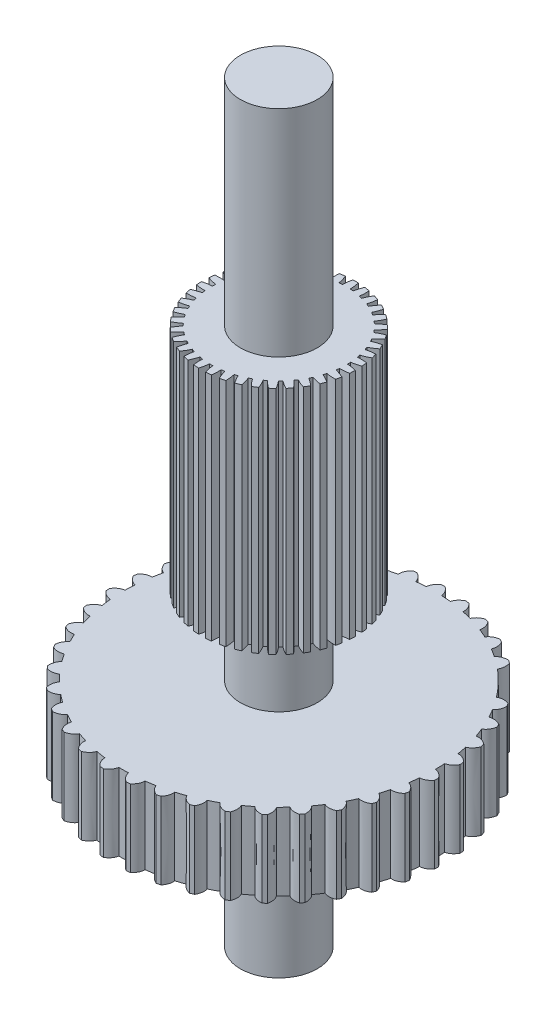
from build123d import *

# Parameters (mm, degrees)
BOSS_EXTRUDE1_DEPTH = 1
SKETCH2_R           = 0.5
BOSS_EXTRUDE2_DEPTH = 1
BOSS_EXTRUDE3_START = 2
SKETCH3_R           = 0.5
BOSS_EXTRUDE3_DEPTH = 2
SKETCH5_R           = 0.88
BOSS_EXTRUDE5_DEPTH = 3
SKETCH6_R           = 0.5
BOSS_EXTRUDE6_DEPTH = 2.8


with BuildPart() as part:
    # Sketch1 → Boss-Extrude1 (new body)
    with BuildSketch(Plane(origin=(0, 0, 0), x_dir=(1, 0, 0), z_dir=(0, 1, 0))):
        with BuildLine():
            Line((0.025, 2.14), (-0.025, 2.14))
            add(Edge.make_bspline(
                [(-0.025, 2.14), (-0.094687317, 2.087833824), (-0.1, 2.017523234)],
                knots=[0, 0, 0, 0.858328442, 0.858328442, 0.858328442], degree=2))
            ThreePointArc((-0.1, 2.017523234), (-0.162542469, 2.013449762), (-0.22492846, 2.007437966))
            add(Edge.make_bspline(
                [(-0.318603884, 2.116297844), (-0.241450957, 2.075985838), (-0.22492846, 2.007437966)],
                knots=[0, 0, 0, 0.858328442, 0.858328442, 0.858328442], degree=2))
            Line((-0.318603884, 2.116297844), (-0.367956398, 2.10827728))
            add(Edge.make_bspline(
                [(-0.367956398, 2.10827728), (-0.428373239, 2.045608011), (-0.422338512, 1.97535571)],
                knots=[0, 0, 0, 0.858328442, 0.858328442, 0.858328442], degree=2))
            ThreePointArc((-0.422338512, 1.97535571), (-0.483417642, 1.961302471), (-0.544031391, 1.945361109))
            add(Edge.make_bspline(
                [(-0.653956096, 2.037784686), (-0.571335778, 2.010370909), (-0.544031391, 1.945361109)],
                knots=[0, 0, 0, 0.858328442, 0.858328442, 0.858328442], degree=2))
            Line((-0.653956096, 2.037784686), (-0.701382918, 2.021951286))
            add(Edge.make_bspline(
                [(-0.701382918, 2.021951286), (-0.750964519, 1.950402024), (-0.733738679, 1.882027511)],
                knots=[0, 0, 0, 0.858328442, 0.858328442, 0.858328442], degree=2))
            ThreePointArc((-0.733738679, 1.882027511), (-0.791772552, 1.858358476), (-0.849044194, 1.832900422))
            add(Edge.make_bspline(
                [(-0.972371188, 1.906493974), (-0.886423302, 1.89268843), (-0.849044194, 1.832900422)],
                knots=[0, 0, 0, 0.858328442, 0.858328442, 0.858328442], degree=2))
            Line((-0.972371188, 1.906493974), (-1.016643989, 1.883257816))
            add(Edge.make_bspline(
                [(-1.016643989, 1.883257816), (-1.054106212, 1.80468165), (-1.0261354, 1.739955787)],
                knots=[0, 0, 0, 0.858328442, 0.858328442, 0.858328442], degree=2))
            ThreePointArc((-1.0261354, 1.739955787), (-1.079620969, 1.707283973), (-1.132067199, 1.672968576))
            add(Edge.make_bspline(
                [(-1.265602376, 1.72582607), (-1.178552929, 1.725986315), (-1.132067199, 1.672968576)],
                knots=[0, 0, 0, 0.858328442, 0.858328442, 0.858328442], degree=2))
            Line((-1.265602376, 1.72582607), (-1.305574515, 1.695788957))
            add(Edge.make_bspline(
                [(-1.305574515, 1.695788957), (-1.329947109, 1.612220969), (-1.291955752, 1.552820123)],
                knots=[0, 0, 0, 0.858328442, 0.858328442, 0.858328442], degree=2))
            ThreePointArc((-1.291955752, 1.552820123), (-1.33950777, 1.511991711), (-1.385770259, 1.469707723))
            add(Edge.make_bspline(
                [(-1.526055128, 1.500460178), (-1.440158653, 1.51458206), (-1.385770259, 1.469707723)],
                knots=[0, 0, 0, 0.858328442, 0.858328442, 0.858328442], degree=2))
            Line((-1.526055128, 1.500460178), (-1.560691346, 1.464400055))
            add(Edge.make_bspline(
                [(-1.560691346, 1.464400055), (-1.571343074, 1.378004612), (-1.524315129, 1.325467233)],
                knots=[0, 0, 0, 0.858328442, 0.858328442, 0.858328442], degree=2))
            ThreePointArc((-1.524315129, 1.325467233), (-1.564702023, 1.277539659), (-1.603582596, 1.228382212))
            add(Edge.make_bspline(
                [(-1.746983854, 1.236233155), (-1.664465025, 1.263950926), (-1.603582596, 1.228382212)],
                knots=[0, 0, 0, 0.858328442, 0.858328442, 0.858328442], degree=2))
            Line((-1.746983854, 1.236233155), (-1.775387092, 1.195083961))
            add(Edge.make_bspline(
                [(-1.775387092, 1.195083961), (-1.772042078, 1.108098659), (-1.717195545, 1.063785438)],
                knots=[0, 0, 0, 0.858328442, 0.858328442, 0.858328442], degree=2))
            ThreePointArc((-1.717195545, 1.063785438), (-1.749371316, 1.01), (-1.779862987, 0.955242246))
            add(Edge.make_bspline(
                [(-1.922666616, 0.939988342), (-1.845662627, 0.980584127), (-1.779862987, 0.955242246)],
                knots=[0, 0, 0, 0.858328442, 0.858328442, 0.858328442], degree=2))
            Line((-1.922666616, 0.939988342), (-1.944101244, 0.894815821))
            add(Edge.make_bspline(
                [(-1.944101244, 0.894815821), (-1.926846124, 0.809493533), (-1.865601499, 0.774552159)],
                knots=[0, 0, 0, 0.858328442, 0.858328442, 0.858328442], degree=2))
            ThreePointArc((-1.865601499, 0.774552159), (-1.88873281, 0.716301872), (-1.910045861, 0.657362009))
            add(Edge.make_bspline(
                [(-2.048553322, 0.619398326), (-1.979058537, 0.671820714), (-1.910045861, 0.657362009)],
                knots=[0, 0, 0, 0.858328442, 0.858328442, 0.858328442], degree=2))
            Line((-2.048553322, 0.619398326), (-2.062464195, 0.57137242))
            add(Edge.make_bspline(
                [(-2.062464195, 0.57137242), (-2.031745867, 0.489922949), (-1.965689353, 0.465258386)],
                knots=[0, 0, 0, 0.858328442, 0.858328442, 0.858328442], degree=2))
            ThreePointArc((-1.965689353, 0.465258386), (-1.979177117, 0.404051901), (-1.99075955, 0.34245644))
            add(Edge.make_bspline(
                [(-2.121383574, 0.282766218), (-2.06119787, 0.345657497), (-1.99075955, 0.34245644)],
                knots=[0, 0, 0, 0.858328442, 0.858328442, 0.858328442], degree=2))
            Line((-2.121383574, 0.282766218), (-2.127410408, 0.233130774))
            add(Edge.make_bspline(
                [(-2.127410408, 0.233130774), (-2.08402446, 0.157663619), (-2.014866886, 0.143914666)],
                knots=[0, 0, 0, 0.858328442, 0.858328442, 0.858328442], degree=2))
            ThreePointArc((-2.014866886, 0.143914666), (-2.018361776, 0.081337199), (-2.019913613, 0.01868143))
            add(Edge.make_bspline(
                [(-2.139271105, -0.061189387), (-2.089953261, 0.010541933), (-2.019913613, 0.01868143)],
                knots=[0, 0, 0, 0.858328442, 0.858328442, 0.858328442], degree=2))
            Line((-2.139271105, -0.061189387), (-2.137257808, -0.111148837))
            add(Edge.make_bspline(
                [(-2.137257808, -0.111148837), (-2.082327913, -0.178679117), (-2.011860425, -0.18115637)],
                knots=[0, 0, 0, 0.858328442, 0.858328442, 0.858328442], degree=2))
            ThreePointArc((-2.011860425, -0.18115637), (-2.005271926, -0.243484094), (-1.996752974, -0.305577419))
            add(Edge.make_bspline(
                [(-2.101752638, -0.403560218), (-2.06457996, -0.324846662), (-1.996752974, -0.305577419)],
                knots=[0, 0, 0, 0.858328442, 0.858328442, 0.858328442], degree=2))
            Line((-2.101752638, -0.403560218), (-2.091751353, -0.452549751))
            add(Edge.make_bspline(
                [(-2.091751353, -0.452549751), (-2.026700168, -0.510394157), (-1.956747836, -0.50153555)],
                knots=[0, 0, 0, 0.858328442, 0.858328442, 0.858328442], degree=2))
            ThreePointArc((-1.956747836, -0.50153555), (-1.940246585, -0.561999277), (-1.921877483, -0.621921974))
            add(Edge.make_bspline(
                [(-2.009799882, -0.735479052), (-1.985735123, -0.651821898), (-1.921877483, -0.621921974)],
                knots=[0, 0, 0, 0.858328442, 0.858328442, 0.858328442], degree=2))
            Line((-2.009799882, -0.735479052), (-1.992069637, -0.782229864))
            add(Edge.make_bspline(
                [(-1.992069637, -0.782229864), (-1.918581952, -0.828890256), (-1.850956505, -0.808925223)],
                knots=[0, 0, 0, 0.858328442, 0.858328442, 0.858328442], degree=2))
            ThreePointArc((-1.850956505, -0.808925223), (-1.824969878, -0.865958974), (-1.797226373, -0.922159077))
            add(Edge.make_bspline(
                [(-1.865794364, -1.048349365), (-1.855460789, -0.96191529), (-1.797226373, -0.922159077)],
                knots=[0, 0, 0, 0.858328442, 0.858328442, 0.858328442], degree=2))
            Line((-1.865794364, -1.048349365), (-1.840794364, -1.091650635))
            add(Edge.make_bspline(
                [(-1.840794364, -1.091650635), (-1.760773472, -1.125918534), (-1.697226373, -1.095364157)],
                knots=[0, 0, 0, 0.858328442, 0.858328442, 0.858328442], degree=2))
            ThreePointArc((-1.697226373, -1.095364157), (-1.662427409, -1.147490788), (-1.626028045, -1.198512743))
            add(Edge.make_bspline(
                [(-1.673465753, -1.33406798), (-1.677130995, -1.247095582), (-1.626028045, -1.198512743)],
                knots=[0, 0, 0, 0.858328442, 0.858328442, 0.858328442], degree=2))
            Line((-1.673465753, -1.33406798), (-1.641843484, -1.372798228))
            add(Edge.make_bspline(
                [(-1.641843484, -1.372798228), (-1.557361884, -1.393786112), (-1.49953897, -1.353433736)],
                knots=[0, 0, 0, 0.858328442, 0.858328442, 0.858328442], degree=2))
            ThreePointArc((-1.49953897, -1.353433736), (-1.456828944, -1.399303194), (-1.412716445, -1.44382556))
            add(Edge.make_bspline(
                [(-1.437795257, -1.585234935), (-1.45536439, -1.499976753), (-1.412716445, -1.44382556)],
                knots=[0, 0, 0, 0.858328442, 0.858328442, 0.858328442], degree=2))
            Line((-1.437795257, -1.585234935), (-1.40036972, -1.618391068))
            add(Edge.make_bspline(
                [(-1.40036972, -1.618391068), (-1.313615441, -1.625555363), (-1.263014295, -1.576450091)],
                knots=[0, 0, 0, 0.858328442, 0.858328442, 0.858328442], degree=2))
            ThreePointArc((-1.263014295, -1.576450091), (-1.213499374, -1.614874382), (-1.162816231, -1.651744052))
            add(Edge.make_bspline(
                [(-1.16488662, -1.795345137), (-1.195904611, -1.714009313), (-1.162816231, -1.651744052)],
                knots=[0, 0, 0, 0.858328442, 0.858328442, 0.858328442], degree=2))
            Line((-1.16488662, -1.795345137), (-1.122627116, -1.822068429))
            add(Edge.make_bspline(
                [(-1.122627116, -1.822068429), (-1.035847048, -1.815223583), (-0.993778213, -1.758637217)],
                knots=[0, 0, 0, 0.858328442, 0.858328442, 0.858328442], degree=2))
            ThreePointArc((-0.993778213, -1.758637217), (-0.938740808, -1.788621172), (-0.882799687, -1.816883241))
            add(Edge.make_bspline(
                [(-0.861808031, -1.958956844), (-0.905471531, -1.883649933), (-0.882799687, -1.816883241)],
                knots=[0, 0, 0, 0.858328442, 0.858328442, 0.858328442], degree=2))
            Line((-0.861808031, -1.958956844), (-0.815809059, -1.978555175))
            add(Edge.make_bspline(
                [(-0.815809059, -1.978555175), (-0.731250761, -1.957878466), (-0.698803798, -1.895276563)],
                knots=[0, 0, 0, 0.858328442, 0.858328442, 0.858328442], degree=2))
            ThreePointArc((-0.698803798, -1.895276563), (-0.639669347, -1.916043613), (-0.579919095, -1.934966109))
            add(Edge.make_bspline(
                [(-0.536409067, -2.071832598), (-0.591587214, -2.00450501), (-0.579919095, -1.934966109)],
                knots=[0, 0, 0, 0.858328442, 0.858328442, 0.858328442], degree=2))
            Line((-0.536409067, -2.071832598), (-0.487861976, -2.083798381))
            add(Edge.make_bspline(
                [(-0.487861976, -2.083798381), (-0.407715463, -2.049825326), (-0.385730731, -1.982829242)],
                knots=[0, 0, 0, 0.858328442, 0.858328442, 0.858328442], degree=2))
            ThreePointArc((-0.385730731, -1.982829242), (-0.324030787, -1.993841531), (-0.262018903, -2.002934371))
            add(Edge.make_bspline(
                [(-0.19711739, -2.131048975), (-0.262381099, -2.073444459), (-0.262018903, -2.002934371)],
                knots=[0, 0, 0, 0.858328442, 0.858328442, 0.858328442], degree=2))
            Line((-0.19711739, -2.131048975), (-0.147279524, -2.135072304))
            add(Edge.make_bspline(
                [(-0.147279524, -2.135072304), (-0.073620549, -2.088682786), (-0.062667441, -2.019027685)],
                knots=[0, 0, 0, 0.858328442, 0.858328442, 0.858328442], degree=2))
            ThreePointArc((-0.062667441, -2.019027685), (0, -2.02), (0.062667441, -2.019027685))
            add(Edge.make_bspline(
                [(0.147279524, -2.135072304), (0.073620549, -2.088682786), (0.062667441, -2.019027685)],
                knots=[0, 0, 0, 0.858328442, 0.858328442, 0.858328442], degree=2))
            Line((0.147279524, -2.135072304), (0.19711739, -2.131048975))
            add(Edge.make_bspline(
                [(0.19711739, -2.131048975), (0.262381099, -2.073444459), (0.262018903, -2.002934371)],
                knots=[0, 0, 0, 0.858328442, 0.858328442, 0.858328442], degree=2))
            ThreePointArc((0.262018903, -2.002934371), (0.324030787, -1.993841531), (0.385730731, -1.982829242))
            add(Edge.make_bspline(
                [(0.487861976, -2.083798381), (0.407715463, -2.049825326), (0.385730731, -1.982829242)],
                knots=[0, 0, 0, 0.858328442, 0.858328442, 0.858328442], degree=2))
            Line((0.487861976, -2.083798381), (0.536409067, -2.071832598))
            add(Edge.make_bspline(
                [(0.536409067, -2.071832598), (0.591587214, -2.00450501), (0.579919095, -1.934966109)],
                knots=[0, 0, 0, 0.858328442, 0.858328442, 0.858328442], degree=2))
            ThreePointArc((0.579919095, -1.934966109), (0.639669347, -1.916043613), (0.698803798, -1.895276563))
            add(Edge.make_bspline(
                [(0.815809059, -1.978555175), (0.731250761, -1.957878466), (0.698803798, -1.895276563)],
                knots=[0, 0, 0, 0.858328442, 0.858328442, 0.858328442], degree=2))
            Line((0.815809059, -1.978555175), (0.861808031, -1.958956844))
            add(Edge.make_bspline(
                [(0.861808031, -1.958956844), (0.905471531, -1.883649933), (0.882799687, -1.816883241)],
                knots=[0, 0, 0, 0.858328442, 0.858328442, 0.858328442], degree=2))
            ThreePointArc((0.882799687, -1.816883241), (0.938740808, -1.788621172), (0.993778213, -1.758637217))
            add(Edge.make_bspline(
                [(1.122627116, -1.822068429), (1.035847048, -1.815223583), (0.993778213, -1.758637217)],
                knots=[0, 0, 0, 0.858328442, 0.858328442, 0.858328442], degree=2))
            Line((1.122627116, -1.822068429), (1.16488662, -1.795345137))
            add(Edge.make_bspline(
                [(1.16488662, -1.795345137), (1.195904611, -1.714009313), (1.162816231, -1.651744052)],
                knots=[0, 0, 0, 0.858328442, 0.858328442, 0.858328442], degree=2))
            ThreePointArc((1.162816231, -1.651744052), (1.213499374, -1.614874382), (1.263014295, -1.576450091))
            add(Edge.make_bspline(
                [(1.40036972, -1.618391068), (1.313615441, -1.625555363), (1.263014295, -1.576450091)],
                knots=[0, 0, 0, 0.858328442, 0.858328442, 0.858328442], degree=2))
            Line((1.40036972, -1.618391068), (1.437795257, -1.585234935))
            add(Edge.make_bspline(
                [(1.437795257, -1.585234935), (1.45536439, -1.499976753), (1.412716445, -1.44382556)],
                knots=[0, 0, 0, 0.858328442, 0.858328442, 0.858328442], degree=2))
            ThreePointArc((1.412716445, -1.44382556), (1.456828944, -1.399303194), (1.49953897, -1.353433736))
            add(Edge.make_bspline(
                [(1.641843484, -1.372798228), (1.557361884, -1.393786112), (1.49953897, -1.353433736)],
                knots=[0, 0, 0, 0.858328442, 0.858328442, 0.858328442], degree=2))
            Line((1.641843484, -1.372798228), (1.673465753, -1.33406798))
            add(Edge.make_bspline(
                [(1.673465753, -1.33406798), (1.677130995, -1.247095582), (1.626028045, -1.198512743)],
                knots=[0, 0, 0, 0.858328442, 0.858328442, 0.858328442], degree=2))
            ThreePointArc((1.626028045, -1.198512743), (1.662427409, -1.147490788), (1.697226373, -1.095364157))
            add(Edge.make_bspline(
                [(1.840794364, -1.091650635), (1.760773472, -1.125918534), (1.697226373, -1.095364157)],
                knots=[0, 0, 0, 0.858328442, 0.858328442, 0.858328442], degree=2))
            Line((1.840794364, -1.091650635), (1.865794364, -1.048349365))
            add(Edge.make_bspline(
                [(1.865794364, -1.048349365), (1.855460789, -0.96191529), (1.797226373, -0.922159077)],
                knots=[0, 0, 0, 0.858328442, 0.858328442, 0.858328442], degree=2))
            ThreePointArc((1.797226373, -0.922159077), (1.824969878, -0.865958974), (1.850956505, -0.808925223))
            add(Edge.make_bspline(
                [(1.992069637, -0.782229864), (1.918581952, -0.828890256), (1.850956505, -0.808925223)],
                knots=[0, 0, 0, 0.858328442, 0.858328442, 0.858328442], degree=2))
            Line((1.992069637, -0.782229864), (2.009799882, -0.735479052))
            add(Edge.make_bspline(
                [(2.009799882, -0.735479052), (1.985735123, -0.651821898), (1.921877483, -0.621921974)],
                knots=[0, 0, 0, 0.858328442, 0.858328442, 0.858328442], degree=2))
            ThreePointArc((1.921877483, -0.621921974), (1.940246585, -0.561999277), (1.956747836, -0.50153555))
            add(Edge.make_bspline(
                [(2.091751353, -0.452549751), (2.026700168, -0.510394157), (1.956747836, -0.50153555)],
                knots=[0, 0, 0, 0.858328442, 0.858328442, 0.858328442], degree=2))
            Line((2.091751353, -0.452549751), (2.101752638, -0.403560218))
            add(Edge.make_bspline(
                [(2.101752638, -0.403560218), (2.06457996, -0.324846662), (1.996752974, -0.305577419)],
                knots=[0, 0, 0, 0.858328442, 0.858328442, 0.858328442], degree=2))
            ThreePointArc((1.996752974, -0.305577419), (2.005271926, -0.243484094), (2.011860425, -0.18115637))
            add(Edge.make_bspline(
                [(2.137257808, -0.111148837), (2.082327913, -0.178679117), (2.011860425, -0.18115637)],
                knots=[0, 0, 0, 0.858328442, 0.858328442, 0.858328442], degree=2))
            Line((2.137257808, -0.111148837), (2.139271105, -0.061189387))
            add(Edge.make_bspline(
                [(2.139271105, -0.061189387), (2.089953261, 0.010541933), (2.019913613, 0.01868143)],
                knots=[0, 0, 0, 0.858328442, 0.858328442, 0.858328442], degree=2))
            ThreePointArc((2.019913613, 0.01868143), (2.018361776, 0.081337199), (2.014866886, 0.143914666))
            add(Edge.make_bspline(
                [(2.127410408, 0.233130774), (2.08402446, 0.157663619), (2.014866886, 0.143914666)],
                knots=[0, 0, 0, 0.858328442, 0.858328442, 0.858328442], degree=2))
            Line((2.127410408, 0.233130774), (2.121383574, 0.282766218))
            add(Edge.make_bspline(
                [(2.121383574, 0.282766218), (2.06119787, 0.345657497), (1.99075955, 0.34245644)],
                knots=[0, 0, 0, 0.858328442, 0.858328442, 0.858328442], degree=2))
            ThreePointArc((1.99075955, 0.34245644), (1.979177117, 0.404051901), (1.965689353, 0.465258386))
            add(Edge.make_bspline(
                [(2.062464195, 0.57137242), (2.031745867, 0.489922949), (1.965689353, 0.465258386)],
                knots=[0, 0, 0, 0.858328442, 0.858328442, 0.858328442], degree=2))
            Line((2.062464195, 0.57137242), (2.048553322, 0.619398326))
            add(Edge.make_bspline(
                [(2.048553322, 0.619398326), (1.979058537, 0.671820714), (1.910045861, 0.657362009)],
                knots=[0, 0, 0, 0.858328442, 0.858328442, 0.858328442], degree=2))
            ThreePointArc((1.910045861, 0.657362009), (1.88873281, 0.716301872), (1.865601499, 0.774552159))
            add(Edge.make_bspline(
                [(1.944101244, 0.894815821), (1.926846124, 0.809493533), (1.865601499, 0.774552159)],
                knots=[0, 0, 0, 0.858328442, 0.858328442, 0.858328442], degree=2))
            Line((1.944101244, 0.894815821), (1.922666616, 0.939988342))
            add(Edge.make_bspline(
                [(1.922666616, 0.939988342), (1.845662627, 0.980584127), (1.779862987, 0.955242246)],
                knots=[0, 0, 0, 0.858328442, 0.858328442, 0.858328442], degree=2))
            ThreePointArc((1.779862987, 0.955242246), (1.749371316, 1.01), (1.717195545, 1.063785438))
            add(Edge.make_bspline(
                [(1.775387092, 1.195083961), (1.772042078, 1.108098659), (1.717195545, 1.063785438)],
                knots=[0, 0, 0, 0.858328442, 0.858328442, 0.858328442], degree=2))
            Line((1.775387092, 1.195083961), (1.746983854, 1.236233155))
            add(Edge.make_bspline(
                [(1.746983854, 1.236233155), (1.664465025, 1.263950926), (1.603582596, 1.228382212)],
                knots=[0, 0, 0, 0.858328442, 0.858328442, 0.858328442], degree=2))
            ThreePointArc((1.603582596, 1.228382212), (1.456828944, 1.399303194), (1.291955752, 1.552820123))
            add(Edge.make_bspline(
                [(1.305574515, 1.695788957), (1.329947109, 1.612220969), (1.291955752, 1.552820123)],
                knots=[0, 0, 0, 0.858328442, 0.858328442, 0.858328442], degree=2))
            Line((1.305574515, 1.695788957), (1.265602376, 1.72582607))
            add(Edge.make_bspline(
                [(1.265602376, 1.72582607), (1.178552929, 1.725986315), (1.132067199, 1.672968576)],
                knots=[0, 0, 0, 0.858328442, 0.858328442, 0.858328442], degree=2))
            ThreePointArc((1.132067199, 1.672968576), (1.079620969, 1.707283973), (1.0261354, 1.739955787))
            add(Edge.make_bspline(
                [(1.016643989, 1.883257816), (1.054106212, 1.80468165), (1.0261354, 1.739955787)],
                knots=[0, 0, 0, 0.858328442, 0.858328442, 0.858328442], degree=2))
            Line((1.016643989, 1.883257816), (0.972371188, 1.906493974))
            add(Edge.make_bspline(
                [(0.972371188, 1.906493974), (0.886423302, 1.89268843), (0.849044194, 1.832900422)],
                knots=[0, 0, 0, 0.858328442, 0.858328442, 0.858328442], degree=2))
            ThreePointArc((0.849044194, 1.832900422), (0.791772552, 1.858358476), (0.733738679, 1.882027511))
            add(Edge.make_bspline(
                [(0.701382918, 2.021951286), (0.750964519, 1.950402024), (0.733738679, 1.882027511)],
                knots=[0, 0, 0, 0.858328442, 0.858328442, 0.858328442], degree=2))
            Line((0.701382918, 2.021951286), (0.653956096, 2.037784686))
            add(Edge.make_bspline(
                [(0.653956096, 2.037784686), (0.571335778, 2.010370909), (0.544031391, 1.945361109)],
                knots=[0, 0, 0, 0.858328442, 0.858328442, 0.858328442], degree=2))
            ThreePointArc((0.544031391, 1.945361109), (0.483417642, 1.961302471), (0.422338512, 1.97535571))
            add(Edge.make_bspline(
                [(0.367956398, 2.10827728), (0.428373239, 2.045608011), (0.422338512, 1.97535571)],
                knots=[0, 0, 0, 0.858328442, 0.858328442, 0.858328442], degree=2))
            Line((0.367956398, 2.10827728), (0.318603884, 2.116297844))
            add(Edge.make_bspline(
                [(0.318603884, 2.116297844), (0.241450957, 2.075985838), (0.22492846, 2.007437966)],
                knots=[0, 0, 0, 0.858328442, 0.858328442, 0.858328442], degree=2))
            ThreePointArc((0.22492846, 2.007437966), (0.162542469, 2.013449762), (0.1, 2.017523234))
            add(Edge.make_bspline(
                [(0.025, 2.14), (0.094687317, 2.087833824), (0.1, 2.017523234)],
                knots=[0, 0, 0, 0.858328442, 0.858328442, 0.858328442], degree=2))
        make_face()
    extrude(amount=BOSS_EXTRUDE1_DEPTH)

    # Sketch2 → Boss-Extrude2 (add)
    with BuildSketch(Plane(origin=(0, 1, 0), x_dir=(1, 0, 0), z_dir=(0, 1, 0))):
        Circle(SKETCH2_R)
    extrude(amount=BOSS_EXTRUDE2_DEPTH)

    # Sketch3 → Boss-Extrude3 (add)
    with BuildSketch(Plane.XZ.offset(BOSS_EXTRUDE3_START)):
        Circle(SKETCH3_R)
    extrude(amount=-BOSS_EXTRUDE3_DEPTH)

    # Sketch5 → Boss-Extrude5 (add)
    with BuildSketch(Plane(origin=(0, 2, 0), x_dir=(1, 0, 0), z_dir=(0, 1, 0))):
        Circle(SKETCH5_R)
        with BuildLine():
            Line((-0.035, 1), (0.035, 1))
            add(Edge.make_bspline(
                [(0.035, 1), (0.048647076, 0.939667454), (0.05, 0.878578397)],
                knots=[0, 0, 0, 0.819610194, 0.819610194, 0.819610194], degree=2))
            Line((0.05, 0.878578397), (0, 0.88))
            Line((0, 0.88), (-0.05, 0.878578397))
            add(Edge.make_bspline(
                [(-0.035, 1), (-0.048647076, 0.939667454), (-0.05, 0.878578397)],
                knots=[0, 0, 0, 0.819610194, 0.819610194, 0.819610194], degree=2))
        make_face()
        with BuildLine():
            Line((0.125864522, 0.992664657), (0.19495804, 0.981435868))
            add(Edge.make_bspline(
                [(0.19495804, 0.981435868), (0.198750369, 0.919695467), (0.190286399, 0.859180474)],
                knots=[0, 0, 0, 0.819610194, 0.819610194, 0.819610194], degree=2))
            Line((0.190286399, 0.859180474), (0.141161927, 0.868604231))
            Line((0.141161927, 0.868604231), (0.091581373, 0.875221602))
            add(Edge.make_bspline(
                [(0.125864522, 0.992664657), (0.10271615, 0.935302547), (0.091581373, 0.875221602)],
                knots=[0, 0, 0, 0.819610194, 0.819610194, 0.819610194], degree=2))
        make_face()
        with BuildLine():
            Line((0.283469218, 0.959619822), (0.349866769, 0.937453062))
            add(Edge.make_bspline(
                [(0.349866769, 0.937453062), (0.343706132, 0.875903851), (0.325644481, 0.817530227)],
                knots=[0, 0, 0, 0.819610194, 0.819610194, 0.819610194], degree=2))
            Line((0.325644481, 0.817530227), (0.278667835, 0.834712069))
            Line((0.278667835, 0.834712069), (0.230790836, 0.849197027))
            add(Edge.make_bspline(
                [(0.283469218, 0.959619822), (0.251419083, 0.906713795), (0.230790836, 0.849197027)],
                knots=[0, 0, 0, 0.819610194, 0.819610194, 0.819610194], degree=2))
        make_face()
        with BuildLine():
            Line((0.433732211, 0.901721337), (0.495714133, 0.869190715))
            add(Edge.make_bspline(
                [(0.495714133, 0.869190715), (0.479760087, 0.809426785), (0.452568541, 0.754706377)],
                knots=[0, 0, 0, 0.819610194, 0.819610194, 0.819610194], degree=2))
            Line((0.452568541, 0.754706377), (0.408956391, 0.779201303))
            Line((0.408956391, 0.779201303), (0.364022938, 0.801178694))
            add(Edge.make_bspline(
                [(0.433732211, 0.901721337), (0.393610393, 0.854641633), (0.364022938, 0.801178694)],
                knots=[0, 0, 0, 0.819610194, 0.819610194, 0.819610194], degree=2))
        make_face()
        with BuildLine():
            Line((0.572761768, 0.820468743), (0.628722761, 0.778416784))
            add(Edge.make_bspline(
                [(0.628722761, 0.778416784), (0.603388507, 0.721985991), (0.567771314, 0.672336029)],
                knots=[0, 0, 0, 0.819610194, 0.819610194, 0.819610194], degree=2))
            Line((0.567771314, 0.672336029), (0.528653193, 0.703509632))
            Line((0.528653193, 0.703509632), (0.487827037, 0.732410255))
            add(Edge.make_bspline(
                [(0.572761768, 0.820468743), (0.525607401, 0.780434701), (0.487827037, 0.732410255)],
                knots=[0, 0, 0, 0.819610194, 0.819610194, 0.819610194], degree=2))
        make_face()
        with BuildLine():
            Line((0.696957095, 0.717966439), (0.7454478, 0.667482268))
            add(Edge.make_bspline(
                [(0.7454478, 0.667482268), (0.711389482, 0.615846139), (0.668269108, 0.57255253)],
                knots=[0, 0, 0, 0.819610194, 0.819610194, 0.819610194], degree=2))
            Line((0.668269108, 0.57255253), (0.634658154, 0.609597431))
            Line((0.634658154, 0.609597431), (0.598996673, 0.644672775))
            add(Edge.make_bspline(
                [(0.696957095, 0.717966439), (0.643991453, 0.68601492), (0.598996673, 0.644672775)],
                knots=[0, 0, 0, 0.819610194, 0.819610194, 0.819610194], degree=2))
        make_face()
        with BuildLine():
            Line((0.8031016, 0.596869182), (0.842866132, 0.539260311))
            add(Edge.make_bspline(
                [(0.842866132, 0.539260311), (0.800965843, 0.493756195), (0.751459083, 0.457940221)],
                knots=[0, 0, 0, 0.819610194, 0.819610194, 0.819610194], degree=2))
            Line((0.751459083, 0.457940221), (0.724225802, 0.499896977))
            Line((0.724225802, 0.499896977), (0.694652608, 0.540238608))
            add(Edge.make_bspline(
                [(0.8031016, 0.596869182), (0.745696465, 0.573827713), (0.694652608, 0.540238608)],
                knots=[0, 0, 0, 0.819610194, 0.819610194, 0.819610194], degree=2))
        make_face()
        with BuildLine():
            Line((0.888446195, 0.460313327), (0.918454674, 0.397071796))
            add(Edge.make_bspline(
                [(0.918454674, 0.397071796), (0.869797609, 0.358878225), (0.815186663, 0.331467502)],
                knots=[0, 0, 0, 0.819610194, 0.819610194, 0.819610194], degree=2))
            Line((0.815186663, 0.331467502), (0.795036382, 0.377249454))
            Line((0.795036382, 0.377249454), (0.772317407, 0.421812545))
            add(Edge.make_bspline(
                [(0.888446195, 0.460313327), (0.82808833, 0.44677867), (0.772317407, 0.421812545)],
                knots=[0, 0, 0, 0.819610194, 0.819610194, 0.819610194], degree=2))
        make_face()
        with BuildLine():
            Line((0.9507805, 0.311835598), (0.970255723, 0.24459933))
            add(Edge.make_bspline(
                [(0.970255723, 0.24459933), (0.916102075, 0.214705498), (0.857801336, 0.196409948)],
                knots=[0, 0, 0, 0.819610194, 0.819610194, 0.819610194], degree=2))
            Line((0.857801336, 0.196409948), (0.845255938, 0.244831368))
            Line((0.845255938, 0.244831368), (0.82997959, 0.292461759))
            add(Edge.make_bspline(
                [(0.9507805, 0.311835598), (0.889033142, 0.308158294), (0.82997959, 0.292461759)],
                knots=[0, 0, 0, 0.819610194, 0.819610194, 0.819610194], degree=2))
        make_face()
        with BuildLine():
            Line((0.98849009, 0.155281491), (0.996927658, 0.08579187))
            add(Edge.make_bspline(
                [(0.996927658, 0.08579187), (0.938679977, 0.064972011), (0.878199405, 0.05626548)],
                knots=[0, 0, 0, 0.819610194, 0.819610194, 0.819610194], degree=2))
            Line((0.878199405, 0.05626548), (0.873583809, 0.106072279))
            Line((0.873583809, 0.106072279), (0.866145737, 0.155536367))
            add(Edge.make_bspline(
                [(0.98849009, 0.155281491), (0.926952463, 0.16155678), (0.866145737, 0.155536367)],
                knots=[0, 0, 0, 0.819610194, 0.819610194, 0.819610194], degree=2))
        make_face()
        with BuildLine():
            Line((1.000598306, -0.005294325), (0.99777969, -0.075237555))
            add(Edge.make_bspline(
                [(0.99777969, -0.075237555), (0.936946562, -0.086444217), (0.875852571, -0.085336235)],
                knots=[0, 0, 0, 0.819610194, 0.819610194, 0.819610194], degree=2))
            Line((0.875852571, -0.085336235), (0.879286318, -0.035434027))
            Line((0.879286318, -0.035434027), (0.879879166, 0.014582665))
            add(Edge.make_bspline(
                [(1.000598306, -0.005294325), (0.940864202, 0.01077103), (0.879879166, 0.014582665)],
                knots=[0, 0, 0, 0.819610194, 0.819610194, 0.819610194], degree=2))
        make_face()
        with BuildLine():
            Line((0.986791551, -0.165733021), (0.972789753, -0.234318367))
            add(Edge.make_bspline(
                [(0.972789753, -0.234318367), (0.910946722, -0.235621585), (0.850821616, -0.224727786)],
                knots=[0, 0, 0, 0.819610194, 0.819610194, 0.819610194], degree=2))
            Line((0.850821616, -0.224727786), (0.862215774, -0.176022611))
            Line((0.862215774, -0.176022611), (0.870824185, -0.126748721))
            add(Edge.make_bspline(
                [(0.986791551, -0.165733021), (0.930408052, -0.140293684), (0.870824185, -0.126748721)],
                knots=[0, 0, 0, 0.819610194, 0.819610194, 0.819610194], degree=2))
        make_face()
        with BuildLine():
            Line((0.947427414, -0.321879319), (0.922605072, -0.387330456))
            add(Edge.make_bspline(
                [(0.922605072, -0.387330456), (0.861353841, -0.378696478), (0.803754827, -0.358299005)],
                knots=[0, 0, 0, 0.819610194, 0.819610194, 0.819610194], degree=2))
            Line((0.803754827, -0.358299005), (0.822814294, -0.312052301))
            Line((0.822814294, -0.312052301), (0.839215316, -0.264797381))
            add(Edge.make_bspline(
                [(0.947427414, -0.321879319), (0.895854823, -0.287724865), (0.839215316, -0.264797381)],
                knots=[0, 0, 0, 0.819610194, 0.819610194, 0.819610194], degree=2))
        make_face()
        with BuildLine():
            Line((0.883525404, -0.469689111), (0.848525404, -0.530310889))
            add(Edge.make_bspline(
                [(0.848525404, -0.530310889), (0.789452348, -0.511963331), (0.735871211, -0.482590469)],
                knots=[0, 0, 0, 0.819610194, 0.819610194, 0.819610194], degree=2))
            Line((0.735871211, -0.482590469), (0.762102355, -0.44))
            Line((0.762102355, -0.44), (0.785871211, -0.395987928))
            add(Edge.make_bspline(
                [(0.883525404, -0.469689111), (0.838099424, -0.427704123), (0.785871211, -0.395987928)],
                knots=[0, 0, 0, 0.819610194, 0.819610194, 0.819610194], degree=2))
        make_face()
        with BuildLine():
            Line((0.79674055, -0.605334202), (0.752469374, -0.659556549))
            add(Edge.make_bspline(
                [(0.752469374, -0.659556549), (0.697104454, -0.631970602), (0.648928917, -0.594383092)],
                knots=[0, 0, 0, 0.819610194, 0.819610194, 0.819610194], degree=2))
            Line((0.648928917, -0.594383092), (0.681652366, -0.556551931))
            Line((0.681652366, -0.556551931), (0.712173455, -0.516922596))
            add(Edge.make_bspline(
                [(0.79674055, -0.605334202), (0.758637691, -0.556606069), (0.712173455, -0.516922596)],
                knots=[0, 0, 0, 0.819610194, 0.819610194, 0.819610194], degree=2))
        make_face()
        with BuildLine():
            Line((0.689320534, -0.725301455), (0.636924782, -0.771720041))
            add(Edge.make_bspline(
                [(0.636924782, -0.771720041), (0.58670192, -0.735610167), (0.545179705, -0.690781506)],
                knots=[0, 0, 0, 0.819610194, 0.819610194, 0.819610194], degree=2))
            Line((0.545179705, -0.690781506), (0.583547939, -0.658689458))
            Line((0.583547939, -0.658689458), (0.62003078, -0.62446924))
            add(Edge.make_bspline(
                [(0.689320534, -0.725301455), (0.659527639, -0.67109221), (0.62003078, -0.62446924)],
                knots=[0, 0, 0, 0.819610194, 0.819610194, 0.819610194], degree=2))
        make_face()
        with BuildLine():
            Line((0.564047479, -0.826483782), (0.504884173, -0.863896389))
            add(Edge.make_bspline(
                [(0.504884173, -0.863896389), (0.461104115, -0.820197816), (0.427310625, -0.769289042)],
                knots=[0, 0, 0, 0.819610194, 0.819610194, 0.819610194], degree=2))
            Line((0.427310625, -0.769289042), (0.470329927, -0.743767275))
            Line((0.470329927, -0.743767275), (0.511829633, -0.715842459))
            add(Edge.make_bspline(
                [(0.564047479, -0.826483782), (0.543336169, -0.768197416), (0.511829633, -0.715842459)],
                knots=[0, 0, 0, 0.819610194, 0.819610194, 0.819610194], degree=2))
        make_face()
        with BuildLine():
            Line((0.42416589, -0.906260612), (0.359767329, -0.933698275))
            add(Edge.make_bspline(
                [(0.359767329, -0.933698275), (0.323563956, -0.883542771), (0.298374424, -0.827872396)],
                knots=[0, 0, 0, 0.819610194, 0.819610194, 0.819610194], degree=2))
            Line((0.298374424, -0.827872396), (0.344930617, -0.80958191))
            Line((0.344930617, -0.80958191), (0.390372368, -0.788675735))
            add(Edge.make_bspline(
                [(0.42416589, -0.906260612), (0.413072577, -0.845406712), (0.390372368, -0.788675735)],
                knots=[0, 0, 0, 0.819610194, 0.819610194, 0.819610194], degree=2))
        make_face()
        with BuildLine():
            Line((0.273298628, -0.962565769), (0.205332701, -0.979317866))
            add(Edge.make_bspline(
                [(0.205332701, -0.979317866), (0.17764366, -0.924004433), (0.161710482, -0.865014289)],
                knots=[0, 0, 0, 0.819610194, 0.819610194, 0.819610194], degree=2))
            Line((0.161710482, -0.865014289), (0.210597785, -0.854428799))
            Line((0.210597785, -0.854428799), (0.258804664, -0.841082722))
            add(Edge.make_bspline(
                [(0.273298628, -0.962565769), (0.272110622, -0.900720418), (0.258804664, -0.841082722)],
                knots=[0, 0, 0, 0.819610194, 0.819610194, 0.819610194], degree=2))
        make_face()
        with BuildLine():
            Line((0.115353075, -0.993940978), (0.045580063, -0.999573638))
            add(Edge.make_bspline(
                [(0.045580063, -0.999573638), (0.027122487, -0.940534865), (0.020858324, -0.879752767)],
                knots=[0, 0, 0, 0.819610194, 0.819610194, 0.819610194], degree=2))
            Line((0.020858324, -0.879752767), (0.07081058, -0.877146431))
            Line((0.07081058, -0.877146431), (0.120534054, -0.87170611))
            add(Edge.make_bspline(
                [(0.115353075, -0.993940978), (0.124101145, -0.932705939), (0.120534054, -0.87170611)],
                knots=[0, 0, 0, 0.819610194, 0.819610194, 0.819610194], degree=2))
        make_face()
        with BuildLine():
            Line((-0.045580063, -0.999573638), (-0.115353075, -0.993940978))
            add(Edge.make_bspline(
                [(-0.115353075, -0.993940978), (-0.124101145, -0.932705939), (-0.120534054, -0.87170611)],
                knots=[0, 0, 0, 0.819610194, 0.819610194, 0.819610194], degree=2))
            Line((-0.120534054, -0.87170611), (-0.07081058, -0.877146431))
            Line((-0.07081058, -0.877146431), (-0.020858324, -0.879752767))
            add(Edge.make_bspline(
                [(-0.045580063, -0.999573638), (-0.027122487, -0.940534865), (-0.020858324, -0.879752767)],
                knots=[0, 0, 0, 0.819610194, 0.819610194, 0.819610194], degree=2))
        make_face()
        with BuildLine():
            Line((-0.205332701, -0.979317866), (-0.273298628, -0.962565769))
            add(Edge.make_bspline(
                [(-0.273298628, -0.962565769), (-0.272110622, -0.900720418), (-0.258804664, -0.841082722)],
                knots=[0, 0, 0, 0.819610194, 0.819610194, 0.819610194], degree=2))
            Line((-0.258804664, -0.841082722), (-0.210597785, -0.854428799))
            Line((-0.210597785, -0.854428799), (-0.161710482, -0.865014289))
            add(Edge.make_bspline(
                [(-0.205332701, -0.979317866), (-0.17764366, -0.924004433), (-0.161710482, -0.865014289)],
                knots=[0, 0, 0, 0.819610194, 0.819610194, 0.819610194], degree=2))
        make_face()
        with BuildLine():
            Line((-0.359767329, -0.933698275), (-0.42416589, -0.906260612))
            add(Edge.make_bspline(
                [(-0.42416589, -0.906260612), (-0.413072577, -0.845406712), (-0.390372368, -0.788675735)],
                knots=[0, 0, 0, 0.819610194, 0.819610194, 0.819610194], degree=2))
            Line((-0.390372368, -0.788675735), (-0.344930617, -0.80958191))
            Line((-0.344930617, -0.80958191), (-0.298374424, -0.827872396))
            add(Edge.make_bspline(
                [(-0.359767329, -0.933698275), (-0.323563956, -0.883542771), (-0.298374424, -0.827872396)],
                knots=[0, 0, 0, 0.819610194, 0.819610194, 0.819610194], degree=2))
        make_face()
        with BuildLine():
            Line((-0.504884173, -0.863896389), (-0.564047479, -0.826483782))
            add(Edge.make_bspline(
                [(-0.564047479, -0.826483782), (-0.543336169, -0.768197416), (-0.511829633, -0.715842459)],
                knots=[0, 0, 0, 0.819610194, 0.819610194, 0.819610194], degree=2))
            Line((-0.511829633, -0.715842459), (-0.470329927, -0.743767275))
            Line((-0.470329927, -0.743767275), (-0.427310625, -0.769289042))
            add(Edge.make_bspline(
                [(-0.504884173, -0.863896389), (-0.461104115, -0.820197816), (-0.427310625, -0.769289042)],
                knots=[0, 0, 0, 0.819610194, 0.819610194, 0.819610194], degree=2))
        make_face()
        with BuildLine():
            Line((-0.636924782, -0.771720041), (-0.689320534, -0.725301455))
            add(Edge.make_bspline(
                [(-0.689320534, -0.725301455), (-0.659527639, -0.67109221), (-0.62003078, -0.62446924)],
                knots=[0, 0, 0, 0.819610194, 0.819610194, 0.819610194], degree=2))
            Line((-0.62003078, -0.62446924), (-0.583547939, -0.658689458))
            Line((-0.583547939, -0.658689458), (-0.545179705, -0.690781506))
            add(Edge.make_bspline(
                [(-0.636924782, -0.771720041), (-0.58670192, -0.735610167), (-0.545179705, -0.690781506)],
                knots=[0, 0, 0, 0.819610194, 0.819610194, 0.819610194], degree=2))
        make_face()
        with BuildLine():
            Line((-0.752469374, -0.659556549), (-0.79674055, -0.605334202))
            add(Edge.make_bspline(
                [(-0.79674055, -0.605334202), (-0.758637691, -0.556606069), (-0.712173455, -0.516922596)],
                knots=[0, 0, 0, 0.819610194, 0.819610194, 0.819610194], degree=2))
            Line((-0.712173455, -0.516922596), (-0.681652366, -0.556551931))
            Line((-0.681652366, -0.556551931), (-0.648928917, -0.594383092))
            add(Edge.make_bspline(
                [(-0.752469374, -0.659556549), (-0.697104454, -0.631970602), (-0.648928917, -0.594383092)],
                knots=[0, 0, 0, 0.819610194, 0.819610194, 0.819610194], degree=2))
        make_face()
        with BuildLine():
            Line((-0.848525404, -0.530310889), (-0.883525404, -0.469689111))
            add(Edge.make_bspline(
                [(-0.883525404, -0.469689111), (-0.838099424, -0.427704123), (-0.785871211, -0.395987928)],
                knots=[0, 0, 0, 0.819610194, 0.819610194, 0.819610194], degree=2))
            Line((-0.785871211, -0.395987928), (-0.762102355, -0.44))
            Line((-0.762102355, -0.44), (-0.735871211, -0.482590469))
            add(Edge.make_bspline(
                [(-0.848525404, -0.530310889), (-0.789452348, -0.511963331), (-0.735871211, -0.482590469)],
                knots=[0, 0, 0, 0.819610194, 0.819610194, 0.819610194], degree=2))
        make_face()
        with BuildLine():
            Line((-0.922605072, -0.387330456), (-0.947427414, -0.321879319))
            add(Edge.make_bspline(
                [(-0.947427414, -0.321879319), (-0.895854823, -0.287724865), (-0.839215316, -0.264797381)],
                knots=[0, 0, 0, 0.819610194, 0.819610194, 0.819610194], degree=2))
            Line((-0.839215316, -0.264797381), (-0.822814294, -0.312052301))
            Line((-0.822814294, -0.312052301), (-0.803754827, -0.358299005))
            add(Edge.make_bspline(
                [(-0.922605072, -0.387330456), (-0.861353841, -0.378696478), (-0.803754827, -0.358299005)],
                knots=[0, 0, 0, 0.819610194, 0.819610194, 0.819610194], degree=2))
        make_face()
        with BuildLine():
            Line((-0.972789753, -0.234318367), (-0.986791551, -0.165733021))
            add(Edge.make_bspline(
                [(-0.986791551, -0.165733021), (-0.930408052, -0.140293684), (-0.870824185, -0.126748721)],
                knots=[0, 0, 0, 0.819610194, 0.819610194, 0.819610194], degree=2))
            Line((-0.870824185, -0.126748721), (-0.862215774, -0.176022611))
            Line((-0.862215774, -0.176022611), (-0.850821616, -0.224727786))
            add(Edge.make_bspline(
                [(-0.972789753, -0.234318367), (-0.910946722, -0.235621585), (-0.850821616, -0.224727786)],
                knots=[0, 0, 0, 0.819610194, 0.819610194, 0.819610194], degree=2))
        make_face()
        with BuildLine():
            Line((-0.99777969, -0.075237555), (-1.000598306, -0.005294325))
            add(Edge.make_bspline(
                [(-1.000598306, -0.005294325), (-0.940864202, 0.01077103), (-0.879879166, 0.014582665)],
                knots=[0, 0, 0, 0.819610194, 0.819610194, 0.819610194], degree=2))
            Line((-0.879879166, 0.014582665), (-0.879286318, -0.035434027))
            Line((-0.879286318, -0.035434027), (-0.875852571, -0.085336235))
            add(Edge.make_bspline(
                [(-0.99777969, -0.075237555), (-0.936946562, -0.086444217), (-0.875852571, -0.085336235)],
                knots=[0, 0, 0, 0.819610194, 0.819610194, 0.819610194], degree=2))
        make_face()
        with BuildLine():
            Line((-0.996927658, 0.08579187), (-0.98849009, 0.155281491))
            add(Edge.make_bspline(
                [(-0.98849009, 0.155281491), (-0.926952463, 0.16155678), (-0.866145737, 0.155536367)],
                knots=[0, 0, 0, 0.819610194, 0.819610194, 0.819610194], degree=2))
            Line((-0.866145737, 0.155536367), (-0.873583809, 0.106072279))
            Line((-0.873583809, 0.106072279), (-0.878199405, 0.05626548))
            add(Edge.make_bspline(
                [(-0.996927658, 0.08579187), (-0.938679977, 0.064972011), (-0.878199405, 0.05626548)],
                knots=[0, 0, 0, 0.819610194, 0.819610194, 0.819610194], degree=2))
        make_face()
        with BuildLine():
            Line((-0.970255723, 0.24459933), (-0.9507805, 0.311835598))
            add(Edge.make_bspline(
                [(-0.9507805, 0.311835598), (-0.889033142, 0.308158294), (-0.82997959, 0.292461759)],
                knots=[0, 0, 0, 0.819610194, 0.819610194, 0.819610194], degree=2))
            Line((-0.82997959, 0.292461759), (-0.845255938, 0.244831368))
            Line((-0.845255938, 0.244831368), (-0.857801336, 0.196409948))
            add(Edge.make_bspline(
                [(-0.970255723, 0.24459933), (-0.916102075, 0.214705498), (-0.857801336, 0.196409948)],
                knots=[0, 0, 0, 0.819610194, 0.819610194, 0.819610194], degree=2))
        make_face()
        with BuildLine():
            Line((-0.918454674, 0.397071796), (-0.888446195, 0.460313327))
            add(Edge.make_bspline(
                [(-0.888446195, 0.460313327), (-0.82808833, 0.44677867), (-0.772317407, 0.421812545)],
                knots=[0, 0, 0, 0.819610194, 0.819610194, 0.819610194], degree=2))
            Line((-0.772317407, 0.421812545), (-0.795036382, 0.377249454))
            Line((-0.795036382, 0.377249454), (-0.815186663, 0.331467502))
            add(Edge.make_bspline(
                [(-0.918454674, 0.397071796), (-0.869797609, 0.358878225), (-0.815186663, 0.331467502)],
                knots=[0, 0, 0, 0.819610194, 0.819610194, 0.819610194], degree=2))
        make_face()
        with BuildLine():
            Line((-0.842866132, 0.539260311), (-0.8031016, 0.596869182))
            add(Edge.make_bspline(
                [(-0.8031016, 0.596869182), (-0.745696465, 0.573827713), (-0.694652608, 0.540238608)],
                knots=[0, 0, 0, 0.819610194, 0.819610194, 0.819610194], degree=2))
            Line((-0.694652608, 0.540238608), (-0.724225802, 0.499896977))
            Line((-0.724225802, 0.499896977), (-0.751459083, 0.457940221))
            add(Edge.make_bspline(
                [(-0.842866132, 0.539260311), (-0.800965843, 0.493756195), (-0.751459083, 0.457940221)],
                knots=[0, 0, 0, 0.819610194, 0.819610194, 0.819610194], degree=2))
        make_face()
        with BuildLine():
            Line((-0.7454478, 0.667482268), (-0.696957095, 0.717966439))
            add(Edge.make_bspline(
                [(-0.696957095, 0.717966439), (-0.643991453, 0.68601492), (-0.598996673, 0.644672775)],
                knots=[0, 0, 0, 0.819610194, 0.819610194, 0.819610194], degree=2))
            Line((-0.598996673, 0.644672775), (-0.634658154, 0.609597431))
            Line((-0.634658154, 0.609597431), (-0.668269108, 0.57255253))
            add(Edge.make_bspline(
                [(-0.7454478, 0.667482268), (-0.711389482, 0.615846139), (-0.668269108, 0.57255253)],
                knots=[0, 0, 0, 0.819610194, 0.819610194, 0.819610194], degree=2))
        make_face()
        with BuildLine():
            Line((-0.628722761, 0.778416784), (-0.572761768, 0.820468743))
            add(Edge.make_bspline(
                [(-0.572761768, 0.820468743), (-0.525607401, 0.780434701), (-0.487827037, 0.732410255)],
                knots=[0, 0, 0, 0.819610194, 0.819610194, 0.819610194], degree=2))
            Line((-0.487827037, 0.732410255), (-0.528653193, 0.703509632))
            Line((-0.528653193, 0.703509632), (-0.567771314, 0.672336029))
            add(Edge.make_bspline(
                [(-0.628722761, 0.778416784), (-0.603388507, 0.721985991), (-0.567771314, 0.672336029)],
                knots=[0, 0, 0, 0.819610194, 0.819610194, 0.819610194], degree=2))
        make_face()
        with BuildLine():
            Line((-0.495714133, 0.869190715), (-0.433732211, 0.901721337))
            add(Edge.make_bspline(
                [(-0.433732211, 0.901721337), (-0.393610393, 0.854641633), (-0.364022938, 0.801178694)],
                knots=[0, 0, 0, 0.819610194, 0.819610194, 0.819610194], degree=2))
            Line((-0.364022938, 0.801178694), (-0.408956391, 0.779201303))
            Line((-0.408956391, 0.779201303), (-0.452568541, 0.754706377))
            add(Edge.make_bspline(
                [(-0.495714133, 0.869190715), (-0.479760087, 0.809426785), (-0.452568541, 0.754706377)],
                knots=[0, 0, 0, 0.819610194, 0.819610194, 0.819610194], degree=2))
        make_face()
        with BuildLine():
            Line((-0.349866769, 0.937453062), (-0.283469218, 0.959619822))
            add(Edge.make_bspline(
                [(-0.283469218, 0.959619822), (-0.251419083, 0.906713795), (-0.230790836, 0.849197027)],
                knots=[0, 0, 0, 0.819610194, 0.819610194, 0.819610194], degree=2))
            Line((-0.230790836, 0.849197027), (-0.278667835, 0.834712069))
            Line((-0.278667835, 0.834712069), (-0.325644481, 0.817530227))
            add(Edge.make_bspline(
                [(-0.349866769, 0.937453062), (-0.343706132, 0.875903851), (-0.325644481, 0.817530227)],
                knots=[0, 0, 0, 0.819610194, 0.819610194, 0.819610194], degree=2))
        make_face()
        with BuildLine():
            Line((-0.19495804, 0.981435868), (-0.125864522, 0.992664657))
            add(Edge.make_bspline(
                [(-0.125864522, 0.992664657), (-0.10271615, 0.935302547), (-0.091581373, 0.875221602)],
                knots=[0, 0, 0, 0.819610194, 0.819610194, 0.819610194], degree=2))
            Line((-0.091581373, 0.875221602), (-0.141161927, 0.868604231))
            Line((-0.141161927, 0.868604231), (-0.190286399, 0.859180474))
            add(Edge.make_bspline(
                [(-0.19495804, 0.981435868), (-0.198750369, 0.919695467), (-0.190286399, 0.859180474)],
                knots=[0, 0, 0, 0.819610194, 0.819610194, 0.819610194], degree=2))
        make_face()
    extrude(amount=BOSS_EXTRUDE5_DEPTH)

    # Sketch6 → Boss-Extrude6 (add)
    with BuildSketch(Plane(origin=(0, 5, 0), x_dir=(1, 0, 0), z_dir=(0, 1, 0))):
        Circle(SKETCH6_R)
    extrude(amount=BOSS_EXTRUDE6_DEPTH)


solid = part.part
